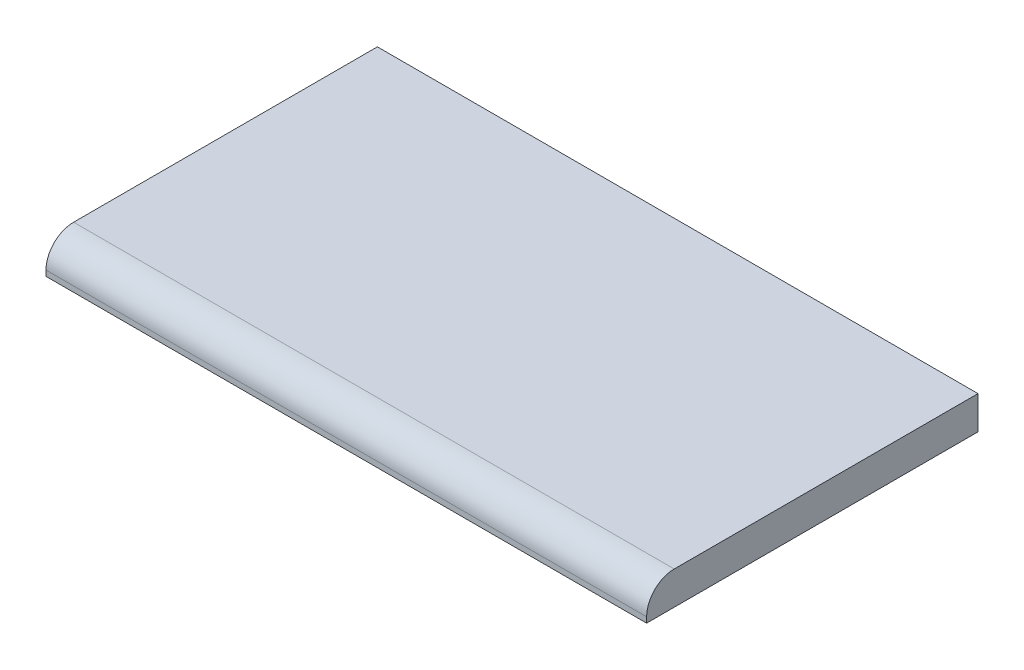
from build123d import *

# Parameters (mm, degrees)
SKETCH1_W           = 276.225
SKETCH1_H           = 152.4
BULK_EXTRUDE_DEPTH  = 15.24
FILLET1_R           = 12.7
SHELL_T             = -1.524
SKETCH2_R           = 1.651
BOSS_EXTRUDE3_DEPTH = 50.8


with BuildPart() as part:
    # Sketch1 → Bulk-Extrude (new body)
    with BuildSketch(Plane(origin=(0, 0, 0), x_dir=(1, 0, 0), z_dir=(0, 1, 0))):
        with Locations((136.5885, 74.676)):
            Rectangle(SKETCH1_W, SKETCH1_H)
    extrude(amount=BULK_EXTRUDE_DEPTH)

    # Fillet1
    fillet1_edges = [part.edges().sort_by_distance(p)[0] for p in [
        (136.5885, 15.24, 1.524),
    ]]
    fillet(fillet1_edges, radius=FILLET1_R)

    # Shell
    shell_openings = [part.faces().sort_by_distance(p)[0] for p in [
        (136.5885, 0, -74.676),
    ]]
    offset(amount=SHELL_T, openings=shell_openings, kind=Kind.INTERSECTION)

    # Sketch2 → Boss-Extrude3 (add, symmetric)
    with BuildSketch(Plane(origin=(136.5885, 0, 0), x_dir=(0, 0, -1), z_dir=(1, 0, 0))):
        with BuildLine():
            Line((150.876, 3.175), (150.876, 0))
            ThreePointArc((150.876, 0), (156.29606403, -2.24506403), (154.051, 3.175))
            Line((154.051, 3.175), (150.876, 3.175))
        make_face()
        with Locations((154.051, 0)):
            Circle(SKETCH2_R, mode=Mode.SUBTRACT)
    extrude(amount=BOSS_EXTRUDE3_DEPTH, both=True)


solid = part.part
